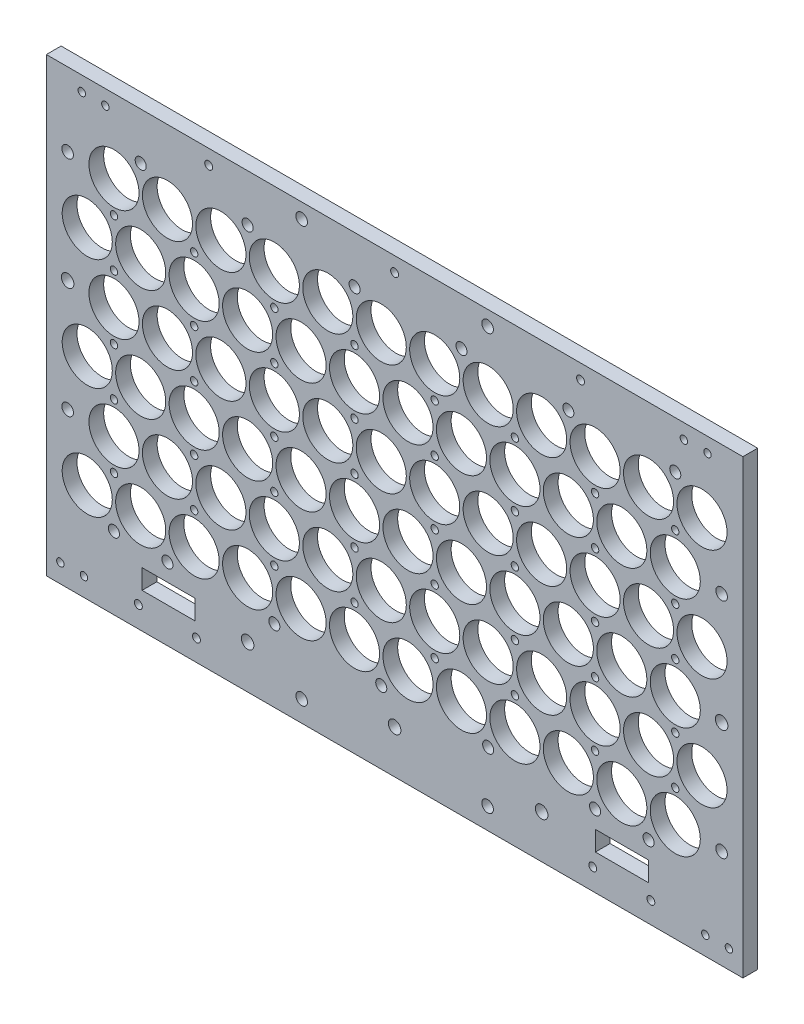
from build123d import *

# Parameters (mm, degrees)
SKETCH1_W                  = 299.700000132
SKETCH1_H                  = 194.250000104
BOSS_EXTRUDE1_DEPTH        = 6.35
CUT_EXTRUDE1_DEPTH         = 182.719853184
SKETCH4_R                  = 10.775
CUT_EXTRUDE2_DEPTH         = 182.719853184
LPATTERN1_COUNT            = 12
LPATTERN1_PITCH            = 23
LPATTERN2_COPY_1_DEPTH     = 182.719853184
LPATTERN2_COPY_2_DEPTH     = 182.719853184
LPATTERN2_COPY_3_DEPTH     = 182.719853184
LPATTERN2_COPY_4_DEPTH     = 182.719853184
LPATTERN2_COPY_5_DEPTH     = 182.719853184
LPATTERN2_COPY_6_DEPTH     = 182.719853184
LPATTERN2_COPY_7_DEPTH     = 182.719853184
LPATTERN2_COPY_8_DEPTH     = 182.719853184
LPATTERN2_COPY_9_DEPTH     = 182.719853184
LPATTERN2_COPY_10_DEPTH    = 182.719853184
LPATTERN2_COPY_11_DEPTH    = 182.719853184
LPATTERN2_COPY_12_DEPTH    = 182.719853184
LPATTERN2_COPY_13_DEPTH    = 182.719853184
LPATTERN2_COPY_14_DEPTH    = 182.719853184
LPATTERN2_COPY_15_DEPTH    = 182.719853184
LPATTERN2_COPY_16_DEPTH    = 182.719853184
LPATTERN2_COPY_17_DEPTH    = 182.719853184
LPATTERN2_COPY_18_DEPTH    = 182.719853184
LPATTERN2_COPY_19_DEPTH    = 182.719853184
LPATTERN2_COPY_20_DEPTH    = 182.719853184
LPATTERN2_COPY_21_DEPTH    = 182.719853184
LPATTERN2_COPY_22_DEPTH    = 182.719853184
LPATTERN2_COPY_23_SKETCH_R = 10.775
LPATTERN2_COPY_23_DEPTH    = 182.719853184
LPATTERN2_COPY_24_SKETCH_R = 10.775
LPATTERN2_COPY_24_DEPTH    = 182.719853184
LPATTERN2_COPY_25_SKETCH_R = 10.775
LPATTERN2_COPY_25_DEPTH    = 182.719853184
LPATTERN2_COPY_26_SKETCH_R = 10.775
LPATTERN2_COPY_26_DEPTH    = 182.719853184
LPATTERN2_COPY_27_SKETCH_R = 10.775
LPATTERN2_COPY_27_DEPTH    = 182.719853184
LPATTERN2_COPY_28_SKETCH_R = 10.775
LPATTERN2_COPY_28_DEPTH    = 182.719853184
LPATTERN2_COPY_29_SKETCH_R = 10.775
LPATTERN2_COPY_29_DEPTH    = 182.719853184
LPATTERN2_COPY_30_SKETCH_R = 10.775
LPATTERN2_COPY_30_DEPTH    = 182.719853184
LPATTERN2_COPY_31_SKETCH_R = 10.775
LPATTERN2_COPY_31_DEPTH    = 182.719853184
LPATTERN2_COPY_32_SKETCH_R = 10.775
LPATTERN2_COPY_32_DEPTH    = 182.719853184
LPATTERN2_COPY_33_SKETCH_R = 10.775
LPATTERN2_COPY_33_DEPTH    = 182.719853184
LPATTERN2_COPY_34_SKETCH_R = 10.775
LPATTERN2_COPY_34_DEPTH    = 182.719853184
LPATTERN2_COPY_35_SKETCH_R = 10.775
LPATTERN2_COPY_35_DEPTH    = 182.719853184
LPATTERN2_COPY_36_SKETCH_R = 10.775
LPATTERN2_COPY_36_DEPTH    = 182.719853184
LPATTERN2_COPY_37_SKETCH_R = 10.775
LPATTERN2_COPY_37_DEPTH    = 182.719853184
LPATTERN2_COPY_38_SKETCH_R = 10.775
LPATTERN2_COPY_38_DEPTH    = 182.719853184
LPATTERN2_COPY_39_SKETCH_R = 10.775
LPATTERN2_COPY_39_DEPTH    = 182.719853184
LPATTERN2_COPY_40_SKETCH_R = 10.775
LPATTERN2_COPY_40_DEPTH    = 182.719853184
LPATTERN2_COPY_41_SKETCH_R = 10.775
LPATTERN2_COPY_41_DEPTH    = 182.719853184
LPATTERN2_COPY_42_SKETCH_R = 10.775
LPATTERN2_COPY_42_DEPTH    = 182.719853184
LPATTERN2_COPY_43_SKETCH_R = 10.775
LPATTERN2_COPY_43_DEPTH    = 182.719853184
LPATTERN2_COPY_44_SKETCH_R = 10.775
LPATTERN2_COPY_44_DEPTH    = 182.719853184
LPATTERN2_COPY_45_DEPTH    = 182.719853184
LPATTERN2_COPY_46_DEPTH    = 182.719853184
LPATTERN2_COPY_47_SKETCH_R = 10.775
LPATTERN2_COPY_47_DEPTH    = 182.719853184
LPATTERN2_COPY_48_SKETCH_R = 10.775
LPATTERN2_COPY_48_DEPTH    = 182.719853184
SKETCH5_W                  = 22.76
SKETCH5_H                  = 8.4615
CUT_EXTRUDE3_DEPTH         = 182.719853184
M3_CLEARANCE_HOLE1_D       = 3.2
M3_CLEARANCE_HOLE2_D       = 3.4
SKETCH14_R                 = 2.7
CUT_EXTRUDE4_DEPTH         = 182.719853184
SKETCH15_R                 = 2.5
CUT_EXTRUDE5_DEPTH         = 182.719853184
SKETCH16_R                 = 1.5875
CUT_EXTRUDE6_DEPTH         = 182.719853184
LPATTERN3_COUNT            = 4
LPATTERN3_PITCH            = 69
SKETCH18_R                 = 2.38125
CUT_EXTRUDE7_DEPTH         = 182.719853184


with BuildPart() as part:
    # Sketch1 → Boss-Extrude1 (new body)
    with BuildSketch(Plane.XY):
        with Locations((0, -5.475000052)):
            Rectangle(SKETCH1_W, SKETCH1_H)
    extrude(amount=BOSS_EXTRUDE1_DEPTH)

    # Sketch3 → Cut-Extrude1 (cut, through all)
    with BuildSketch(Plane.XY.offset(6.35)):
        with BuildLine():
            ThreePointArc((-121.475, -60), (-132.24999993, -49.225), (-143.025, -59.999999859))
            ThreePointArc((-143.025, -59.999999859), (-139.869075617, -67.619075517), (-132.25, -70.775))
            ThreePointArc((-132.25, -70.775), (-124.630924433, -67.619075567), (-121.475, -60))
        make_face()
    cut_extrude1 = extrude(amount=-CUT_EXTRUDE1_DEPTH, mode=Mode.SUBTRACT)

    # Sketch4 → Cut-Extrude2 (cut, through all)
    with BuildSketch(Plane.XY.offset(6.35)):
        with Locations((-120.75, -36)):
            Circle(SKETCH4_R)
    cut_extrude2 = extrude(amount=-CUT_EXTRUDE2_DEPTH, mode=Mode.SUBTRACT)

    # LPattern1: Cut-Extrude1, Cut-Extrude2 ×12
    with Locations(*[(i * LPATTERN1_PITCH, 0, 0) for i in range(1, LPATTERN1_COUNT)]):
        add(cut_extrude1, mode=Mode.SUBTRACT)
        add(cut_extrude2, mode=Mode.SUBTRACT)

    # LPattern2 copy 1 sketch → LPattern2 copy 1 (cut, through all)
    with BuildSketch(Plane(origin=(23, 48, 6.35), x_dir=(1, 0, 0), z_dir=(0, 0, 1))):
        with BuildLine():
            ThreePointArc((-121.475, -60), (-132.24999993, -49.225), (-143.025, -59.999999859))
            ThreePointArc((-143.025, -59.999999859), (-139.869075617, -67.619075517), (-132.25, -70.775))
            ThreePointArc((-132.25, -70.775), (-124.630924433, -67.619075567), (-121.475, -60))
        make_face()
    extrude(amount=-LPATTERN2_COPY_1_DEPTH, mode=Mode.SUBTRACT)

    # LPattern2 copy 2 sketch → LPattern2 copy 2 (cut, through all)
    with BuildSketch(Plane(origin=(23, 96, 6.35), x_dir=(1, 0, 0), z_dir=(0, 0, 1))):
        with BuildLine():
            ThreePointArc((-121.475, -60), (-132.24999993, -49.225), (-143.025, -59.999999859))
            ThreePointArc((-143.025, -59.999999859), (-139.869075617, -67.619075517), (-132.25, -70.775))
            ThreePointArc((-132.25, -70.775), (-124.630924433, -67.619075567), (-121.475, -60))
        make_face()
    extrude(amount=-LPATTERN2_COPY_2_DEPTH, mode=Mode.SUBTRACT)

    # LPattern2 copy 3 sketch → LPattern2 copy 3 (cut, through all)
    with BuildSketch(Plane(origin=(46, 48, 6.35), x_dir=(1, 0, 0), z_dir=(0, 0, 1))):
        with BuildLine():
            ThreePointArc((-121.475, -60), (-132.24999993, -49.225), (-143.025, -59.999999859))
            ThreePointArc((-143.025, -59.999999859), (-139.869075617, -67.619075517), (-132.25, -70.775))
            ThreePointArc((-132.25, -70.775), (-124.630924433, -67.619075567), (-121.475, -60))
        make_face()
    extrude(amount=-LPATTERN2_COPY_3_DEPTH, mode=Mode.SUBTRACT)

    # LPattern2 copy 4 sketch → LPattern2 copy 4 (cut, through all)
    with BuildSketch(Plane(origin=(46, 96, 6.35), x_dir=(1, 0, 0), z_dir=(0, 0, 1))):
        with BuildLine():
            ThreePointArc((-121.475, -60), (-132.24999993, -49.225), (-143.025, -59.999999859))
            ThreePointArc((-143.025, -59.999999859), (-139.869075617, -67.619075517), (-132.25, -70.775))
            ThreePointArc((-132.25, -70.775), (-124.630924433, -67.619075567), (-121.475, -60))
        make_face()
    extrude(amount=-LPATTERN2_COPY_4_DEPTH, mode=Mode.SUBTRACT)

    # LPattern2 copy 5 sketch → LPattern2 copy 5 (cut, through all)
    with BuildSketch(Plane(origin=(69, 48, 6.35), x_dir=(1, 0, 0), z_dir=(0, 0, 1))):
        with BuildLine():
            ThreePointArc((-121.475, -60), (-132.24999993, -49.225), (-143.025, -59.999999859))
            ThreePointArc((-143.025, -59.999999859), (-139.869075617, -67.619075517), (-132.25, -70.775))
            ThreePointArc((-132.25, -70.775), (-124.630924433, -67.619075567), (-121.475, -60))
        make_face()
    extrude(amount=-LPATTERN2_COPY_5_DEPTH, mode=Mode.SUBTRACT)

    # LPattern2 copy 6 sketch → LPattern2 copy 6 (cut, through all)
    with BuildSketch(Plane(origin=(69, 96, 6.35), x_dir=(1, 0, 0), z_dir=(0, 0, 1))):
        with BuildLine():
            ThreePointArc((-121.475, -60), (-132.24999993, -49.225), (-143.025, -59.999999859))
            ThreePointArc((-143.025, -59.999999859), (-139.869075617, -67.619075517), (-132.25, -70.775))
            ThreePointArc((-132.25, -70.775), (-124.630924433, -67.619075567), (-121.475, -60))
        make_face()
    extrude(amount=-LPATTERN2_COPY_6_DEPTH, mode=Mode.SUBTRACT)

    # LPattern2 copy 7 sketch → LPattern2 copy 7 (cut, through all)
    with BuildSketch(Plane(origin=(92, 48, 6.35), x_dir=(1, 0, 0), z_dir=(0, 0, 1))):
        with BuildLine():
            ThreePointArc((-121.475, -60), (-132.24999993, -49.225), (-143.025, -59.999999859))
            ThreePointArc((-143.025, -59.999999859), (-139.869075617, -67.619075517), (-132.25, -70.775))
            ThreePointArc((-132.25, -70.775), (-124.630924433, -67.619075567), (-121.475, -60))
        make_face()
    extrude(amount=-LPATTERN2_COPY_7_DEPTH, mode=Mode.SUBTRACT)

    # LPattern2 copy 8 sketch → LPattern2 copy 8 (cut, through all)
    with BuildSketch(Plane(origin=(92, 96, 6.35), x_dir=(1, 0, 0), z_dir=(0, 0, 1))):
        with BuildLine():
            ThreePointArc((-121.475, -60), (-132.24999993, -49.225), (-143.025, -59.999999859))
            ThreePointArc((-143.025, -59.999999859), (-139.869075617, -67.619075517), (-132.25, -70.775))
            ThreePointArc((-132.25, -70.775), (-124.630924433, -67.619075567), (-121.475, -60))
        make_face()
    extrude(amount=-LPATTERN2_COPY_8_DEPTH, mode=Mode.SUBTRACT)

    # LPattern2 copy 9 sketch → LPattern2 copy 9 (cut, through all)
    with BuildSketch(Plane(origin=(115, 48, 6.35), x_dir=(1, 0, 0), z_dir=(0, 0, 1))):
        with BuildLine():
            ThreePointArc((-121.475, -60), (-132.24999993, -49.225), (-143.025, -59.999999859))
            ThreePointArc((-143.025, -59.999999859), (-139.869075617, -67.619075517), (-132.25, -70.775))
            ThreePointArc((-132.25, -70.775), (-124.630924433, -67.619075567), (-121.475, -60))
        make_face()
    extrude(amount=-LPATTERN2_COPY_9_DEPTH, mode=Mode.SUBTRACT)

    # LPattern2 copy 10 sketch → LPattern2 copy 10 (cut, through all)
    with BuildSketch(Plane(origin=(115, 96, 6.35), x_dir=(1, 0, 0), z_dir=(0, 0, 1))):
        with BuildLine():
            ThreePointArc((-121.475, -60), (-132.24999993, -49.225), (-143.025, -59.999999859))
            ThreePointArc((-143.025, -59.999999859), (-139.869075617, -67.619075517), (-132.25, -70.775))
            ThreePointArc((-132.25, -70.775), (-124.630924433, -67.619075567), (-121.475, -60))
        make_face()
    extrude(amount=-LPATTERN2_COPY_10_DEPTH, mode=Mode.SUBTRACT)

    # LPattern2 copy 11 sketch → LPattern2 copy 11 (cut, through all)
    with BuildSketch(Plane(origin=(138, 48, 6.35), x_dir=(1, 0, 0), z_dir=(0, 0, 1))):
        with BuildLine():
            ThreePointArc((-121.475, -60), (-132.24999993, -49.225), (-143.025, -59.999999859))
            ThreePointArc((-143.025, -59.999999859), (-139.869075617, -67.619075517), (-132.25, -70.775))
            ThreePointArc((-132.25, -70.775), (-124.630924433, -67.619075567), (-121.475, -60))
        make_face()
    extrude(amount=-LPATTERN2_COPY_11_DEPTH, mode=Mode.SUBTRACT)

    # LPattern2 copy 12 sketch → LPattern2 copy 12 (cut, through all)
    with BuildSketch(Plane(origin=(138, 96, 6.35), x_dir=(1, 0, 0), z_dir=(0, 0, 1))):
        with BuildLine():
            ThreePointArc((-121.475, -60), (-132.24999993, -49.225), (-143.025, -59.999999859))
            ThreePointArc((-143.025, -59.999999859), (-139.869075617, -67.619075517), (-132.25, -70.775))
            ThreePointArc((-132.25, -70.775), (-124.630924433, -67.619075567), (-121.475, -60))
        make_face()
    extrude(amount=-LPATTERN2_COPY_12_DEPTH, mode=Mode.SUBTRACT)

    # LPattern2 copy 13 sketch → LPattern2 copy 13 (cut, through all)
    with BuildSketch(Plane(origin=(161, 48, 6.35), x_dir=(1, 0, 0), z_dir=(0, 0, 1))):
        with BuildLine():
            ThreePointArc((-121.475, -60), (-132.24999993, -49.225), (-143.025, -59.999999859))
            ThreePointArc((-143.025, -59.999999859), (-139.869075617, -67.619075517), (-132.25, -70.775))
            ThreePointArc((-132.25, -70.775), (-124.630924433, -67.619075567), (-121.475, -60))
        make_face()
    extrude(amount=-LPATTERN2_COPY_13_DEPTH, mode=Mode.SUBTRACT)

    # LPattern2 copy 14 sketch → LPattern2 copy 14 (cut, through all)
    with BuildSketch(Plane(origin=(161, 96, 6.35), x_dir=(1, 0, 0), z_dir=(0, 0, 1))):
        with BuildLine():
            ThreePointArc((-121.475, -60), (-132.24999993, -49.225), (-143.025, -59.999999859))
            ThreePointArc((-143.025, -59.999999859), (-139.869075617, -67.619075517), (-132.25, -70.775))
            ThreePointArc((-132.25, -70.775), (-124.630924433, -67.619075567), (-121.475, -60))
        make_face()
    extrude(amount=-LPATTERN2_COPY_14_DEPTH, mode=Mode.SUBTRACT)

    # LPattern2 copy 15 sketch → LPattern2 copy 15 (cut, through all)
    with BuildSketch(Plane(origin=(184, 48, 6.35), x_dir=(1, 0, 0), z_dir=(0, 0, 1))):
        with BuildLine():
            ThreePointArc((-121.475, -60), (-132.24999993, -49.225), (-143.025, -59.999999859))
            ThreePointArc((-143.025, -59.999999859), (-139.869075617, -67.619075517), (-132.25, -70.775))
            ThreePointArc((-132.25, -70.775), (-124.630924433, -67.619075567), (-121.475, -60))
        make_face()
    extrude(amount=-LPATTERN2_COPY_15_DEPTH, mode=Mode.SUBTRACT)

    # LPattern2 copy 16 sketch → LPattern2 copy 16 (cut, through all)
    with BuildSketch(Plane(origin=(184, 96, 6.35), x_dir=(1, 0, 0), z_dir=(0, 0, 1))):
        with BuildLine():
            ThreePointArc((-121.475, -60), (-132.24999993, -49.225), (-143.025, -59.999999859))
            ThreePointArc((-143.025, -59.999999859), (-139.869075617, -67.619075517), (-132.25, -70.775))
            ThreePointArc((-132.25, -70.775), (-124.630924433, -67.619075567), (-121.475, -60))
        make_face()
    extrude(amount=-LPATTERN2_COPY_16_DEPTH, mode=Mode.SUBTRACT)

    # LPattern2 copy 17 sketch → LPattern2 copy 17 (cut, through all)
    with BuildSketch(Plane(origin=(207, 48, 6.35), x_dir=(1, 0, 0), z_dir=(0, 0, 1))):
        with BuildLine():
            ThreePointArc((-121.475, -60), (-132.24999993, -49.225), (-143.025, -59.999999859))
            ThreePointArc((-143.025, -59.999999859), (-139.869075617, -67.619075517), (-132.25, -70.775))
            ThreePointArc((-132.25, -70.775), (-124.630924433, -67.619075567), (-121.475, -60))
        make_face()
    extrude(amount=-LPATTERN2_COPY_17_DEPTH, mode=Mode.SUBTRACT)

    # LPattern2 copy 18 sketch → LPattern2 copy 18 (cut, through all)
    with BuildSketch(Plane(origin=(207, 96, 6.35), x_dir=(1, 0, 0), z_dir=(0, 0, 1))):
        with BuildLine():
            ThreePointArc((-121.475, -60), (-132.24999993, -49.225), (-143.025, -59.999999859))
            ThreePointArc((-143.025, -59.999999859), (-139.869075617, -67.619075517), (-132.25, -70.775))
            ThreePointArc((-132.25, -70.775), (-124.630924433, -67.619075567), (-121.475, -60))
        make_face()
    extrude(amount=-LPATTERN2_COPY_18_DEPTH, mode=Mode.SUBTRACT)

    # LPattern2 copy 19 sketch → LPattern2 copy 19 (cut, through all)
    with BuildSketch(Plane(origin=(230, 48, 6.35), x_dir=(1, 0, 0), z_dir=(0, 0, 1))):
        with BuildLine():
            ThreePointArc((-121.475, -60), (-132.24999993, -49.225), (-143.025, -59.999999859))
            ThreePointArc((-143.025, -59.999999859), (-139.869075617, -67.619075517), (-132.25, -70.775))
            ThreePointArc((-132.25, -70.775), (-124.630924433, -67.619075567), (-121.475, -60))
        make_face()
    extrude(amount=-LPATTERN2_COPY_19_DEPTH, mode=Mode.SUBTRACT)

    # LPattern2 copy 20 sketch → LPattern2 copy 20 (cut, through all)
    with BuildSketch(Plane(origin=(230, 96, 6.35), x_dir=(1, 0, 0), z_dir=(0, 0, 1))):
        with BuildLine():
            ThreePointArc((-121.475, -60), (-132.24999993, -49.225), (-143.025, -59.999999859))
            ThreePointArc((-143.025, -59.999999859), (-139.869075617, -67.619075517), (-132.25, -70.775))
            ThreePointArc((-132.25, -70.775), (-124.630924433, -67.619075567), (-121.475, -60))
        make_face()
    extrude(amount=-LPATTERN2_COPY_20_DEPTH, mode=Mode.SUBTRACT)

    # LPattern2 copy 21 sketch → LPattern2 copy 21 (cut, through all)
    with BuildSketch(Plane(origin=(253, 48, 6.35), x_dir=(1, 0, 0), z_dir=(0, 0, 1))):
        with BuildLine():
            ThreePointArc((-121.475, -60), (-132.24999993, -49.225), (-143.025, -59.999999859))
            ThreePointArc((-143.025, -59.999999859), (-139.869075617, -67.619075517), (-132.25, -70.775))
            ThreePointArc((-132.25, -70.775), (-124.630924433, -67.619075567), (-121.475, -60))
        make_face()
    extrude(amount=-LPATTERN2_COPY_21_DEPTH, mode=Mode.SUBTRACT)

    # LPattern2 copy 22 sketch → LPattern2 copy 22 (cut, through all)
    with BuildSketch(Plane(origin=(253, 96, 6.35), x_dir=(1, 0, 0), z_dir=(0, 0, 1))):
        with BuildLine():
            ThreePointArc((-121.475, -60), (-132.24999993, -49.225), (-143.025, -59.999999859))
            ThreePointArc((-143.025, -59.999999859), (-139.869075617, -67.619075517), (-132.25, -70.775))
            ThreePointArc((-132.25, -70.775), (-124.630924433, -67.619075567), (-121.475, -60))
        make_face()
    extrude(amount=-LPATTERN2_COPY_22_DEPTH, mode=Mode.SUBTRACT)

    # LPattern2 copy 23 sketch → LPattern2 copy 23 (cut, through all)
    with BuildSketch(Plane(origin=(23, 48, 6.35), x_dir=(1, 0, 0), z_dir=(0, 0, 1))):
        with Locations((-120.75, -36)):
            Circle(LPATTERN2_COPY_23_SKETCH_R)
    extrude(amount=-LPATTERN2_COPY_23_DEPTH, mode=Mode.SUBTRACT)

    # LPattern2 copy 24 sketch → LPattern2 copy 24 (cut, through all)
    with BuildSketch(Plane(origin=(23, 96, 6.35), x_dir=(1, 0, 0), z_dir=(0, 0, 1))):
        with Locations((-120.75, -36)):
            Circle(LPATTERN2_COPY_24_SKETCH_R)
    extrude(amount=-LPATTERN2_COPY_24_DEPTH, mode=Mode.SUBTRACT)

    # LPattern2 copy 25 sketch → LPattern2 copy 25 (cut, through all)
    with BuildSketch(Plane(origin=(46, 48, 6.35), x_dir=(1, 0, 0), z_dir=(0, 0, 1))):
        with Locations((-120.75, -36)):
            Circle(LPATTERN2_COPY_25_SKETCH_R)
    extrude(amount=-LPATTERN2_COPY_25_DEPTH, mode=Mode.SUBTRACT)

    # LPattern2 copy 26 sketch → LPattern2 copy 26 (cut, through all)
    with BuildSketch(Plane(origin=(46, 96, 6.35), x_dir=(1, 0, 0), z_dir=(0, 0, 1))):
        with Locations((-120.75, -36)):
            Circle(LPATTERN2_COPY_26_SKETCH_R)
    extrude(amount=-LPATTERN2_COPY_26_DEPTH, mode=Mode.SUBTRACT)

    # LPattern2 copy 27 sketch → LPattern2 copy 27 (cut, through all)
    with BuildSketch(Plane(origin=(69, 48, 6.35), x_dir=(1, 0, 0), z_dir=(0, 0, 1))):
        with Locations((-120.75, -36)):
            Circle(LPATTERN2_COPY_27_SKETCH_R)
    extrude(amount=-LPATTERN2_COPY_27_DEPTH, mode=Mode.SUBTRACT)

    # LPattern2 copy 28 sketch → LPattern2 copy 28 (cut, through all)
    with BuildSketch(Plane(origin=(69, 96, 6.35), x_dir=(1, 0, 0), z_dir=(0, 0, 1))):
        with Locations((-120.75, -36)):
            Circle(LPATTERN2_COPY_28_SKETCH_R)
    extrude(amount=-LPATTERN2_COPY_28_DEPTH, mode=Mode.SUBTRACT)

    # LPattern2 copy 29 sketch → LPattern2 copy 29 (cut, through all)
    with BuildSketch(Plane(origin=(92, 48, 6.35), x_dir=(1, 0, 0), z_dir=(0, 0, 1))):
        with Locations((-120.75, -36)):
            Circle(LPATTERN2_COPY_29_SKETCH_R)
    extrude(amount=-LPATTERN2_COPY_29_DEPTH, mode=Mode.SUBTRACT)

    # LPattern2 copy 30 sketch → LPattern2 copy 30 (cut, through all)
    with BuildSketch(Plane(origin=(92, 96, 6.35), x_dir=(1, 0, 0), z_dir=(0, 0, 1))):
        with Locations((-120.75, -36)):
            Circle(LPATTERN2_COPY_30_SKETCH_R)
    extrude(amount=-LPATTERN2_COPY_30_DEPTH, mode=Mode.SUBTRACT)

    # LPattern2 copy 31 sketch → LPattern2 copy 31 (cut, through all)
    with BuildSketch(Plane(origin=(115, 48, 6.35), x_dir=(1, 0, 0), z_dir=(0, 0, 1))):
        with Locations((-120.75, -36)):
            Circle(LPATTERN2_COPY_31_SKETCH_R)
    extrude(amount=-LPATTERN2_COPY_31_DEPTH, mode=Mode.SUBTRACT)

    # LPattern2 copy 32 sketch → LPattern2 copy 32 (cut, through all)
    with BuildSketch(Plane(origin=(115, 96, 6.35), x_dir=(1, 0, 0), z_dir=(0, 0, 1))):
        with Locations((-120.75, -36)):
            Circle(LPATTERN2_COPY_32_SKETCH_R)
    extrude(amount=-LPATTERN2_COPY_32_DEPTH, mode=Mode.SUBTRACT)

    # LPattern2 copy 33 sketch → LPattern2 copy 33 (cut, through all)
    with BuildSketch(Plane(origin=(138, 48, 6.35), x_dir=(1, 0, 0), z_dir=(0, 0, 1))):
        with Locations((-120.75, -36)):
            Circle(LPATTERN2_COPY_33_SKETCH_R)
    extrude(amount=-LPATTERN2_COPY_33_DEPTH, mode=Mode.SUBTRACT)

    # LPattern2 copy 34 sketch → LPattern2 copy 34 (cut, through all)
    with BuildSketch(Plane(origin=(138, 96, 6.35), x_dir=(1, 0, 0), z_dir=(0, 0, 1))):
        with Locations((-120.75, -36)):
            Circle(LPATTERN2_COPY_34_SKETCH_R)
    extrude(amount=-LPATTERN2_COPY_34_DEPTH, mode=Mode.SUBTRACT)

    # LPattern2 copy 35 sketch → LPattern2 copy 35 (cut, through all)
    with BuildSketch(Plane(origin=(161, 48, 6.35), x_dir=(1, 0, 0), z_dir=(0, 0, 1))):
        with Locations((-120.75, -36)):
            Circle(LPATTERN2_COPY_35_SKETCH_R)
    extrude(amount=-LPATTERN2_COPY_35_DEPTH, mode=Mode.SUBTRACT)

    # LPattern2 copy 36 sketch → LPattern2 copy 36 (cut, through all)
    with BuildSketch(Plane(origin=(161, 96, 6.35), x_dir=(1, 0, 0), z_dir=(0, 0, 1))):
        with Locations((-120.75, -36)):
            Circle(LPATTERN2_COPY_36_SKETCH_R)
    extrude(amount=-LPATTERN2_COPY_36_DEPTH, mode=Mode.SUBTRACT)

    # LPattern2 copy 37 sketch → LPattern2 copy 37 (cut, through all)
    with BuildSketch(Plane(origin=(184, 48, 6.35), x_dir=(1, 0, 0), z_dir=(0, 0, 1))):
        with Locations((-120.75, -36)):
            Circle(LPATTERN2_COPY_37_SKETCH_R)
    extrude(amount=-LPATTERN2_COPY_37_DEPTH, mode=Mode.SUBTRACT)

    # LPattern2 copy 38 sketch → LPattern2 copy 38 (cut, through all)
    with BuildSketch(Plane(origin=(184, 96, 6.35), x_dir=(1, 0, 0), z_dir=(0, 0, 1))):
        with Locations((-120.75, -36)):
            Circle(LPATTERN2_COPY_38_SKETCH_R)
    extrude(amount=-LPATTERN2_COPY_38_DEPTH, mode=Mode.SUBTRACT)

    # LPattern2 copy 39 sketch → LPattern2 copy 39 (cut, through all)
    with BuildSketch(Plane(origin=(207, 48, 6.35), x_dir=(1, 0, 0), z_dir=(0, 0, 1))):
        with Locations((-120.75, -36)):
            Circle(LPATTERN2_COPY_39_SKETCH_R)
    extrude(amount=-LPATTERN2_COPY_39_DEPTH, mode=Mode.SUBTRACT)

    # LPattern2 copy 40 sketch → LPattern2 copy 40 (cut, through all)
    with BuildSketch(Plane(origin=(207, 96, 6.35), x_dir=(1, 0, 0), z_dir=(0, 0, 1))):
        with Locations((-120.75, -36)):
            Circle(LPATTERN2_COPY_40_SKETCH_R)
    extrude(amount=-LPATTERN2_COPY_40_DEPTH, mode=Mode.SUBTRACT)

    # LPattern2 copy 41 sketch → LPattern2 copy 41 (cut, through all)
    with BuildSketch(Plane(origin=(230, 48, 6.35), x_dir=(1, 0, 0), z_dir=(0, 0, 1))):
        with Locations((-120.75, -36)):
            Circle(LPATTERN2_COPY_41_SKETCH_R)
    extrude(amount=-LPATTERN2_COPY_41_DEPTH, mode=Mode.SUBTRACT)

    # LPattern2 copy 42 sketch → LPattern2 copy 42 (cut, through all)
    with BuildSketch(Plane(origin=(230, 96, 6.35), x_dir=(1, 0, 0), z_dir=(0, 0, 1))):
        with Locations((-120.75, -36)):
            Circle(LPATTERN2_COPY_42_SKETCH_R)
    extrude(amount=-LPATTERN2_COPY_42_DEPTH, mode=Mode.SUBTRACT)

    # LPattern2 copy 43 sketch → LPattern2 copy 43 (cut, through all)
    with BuildSketch(Plane(origin=(253, 48, 6.35), x_dir=(1, 0, 0), z_dir=(0, 0, 1))):
        with Locations((-120.75, -36)):
            Circle(LPATTERN2_COPY_43_SKETCH_R)
    extrude(amount=-LPATTERN2_COPY_43_DEPTH, mode=Mode.SUBTRACT)

    # LPattern2 copy 44 sketch → LPattern2 copy 44 (cut, through all)
    with BuildSketch(Plane(origin=(253, 96, 6.35), x_dir=(1, 0, 0), z_dir=(0, 0, 1))):
        with Locations((-120.75, -36)):
            Circle(LPATTERN2_COPY_44_SKETCH_R)
    extrude(amount=-LPATTERN2_COPY_44_DEPTH, mode=Mode.SUBTRACT)

    # LPattern2 copy 45 sketch → LPattern2 copy 45 (cut, through all)
    with BuildSketch(Plane(origin=(0, 48, 6.35), x_dir=(1, 0, 0), z_dir=(0, 0, 1))):
        with BuildLine():
            ThreePointArc((-121.475, -60), (-132.24999993, -49.225), (-143.025, -59.999999859))
            ThreePointArc((-143.025, -59.999999859), (-139.869075617, -67.619075517), (-132.25, -70.775))
            ThreePointArc((-132.25, -70.775), (-124.630924433, -67.619075567), (-121.475, -60))
        make_face()
    extrude(amount=-LPATTERN2_COPY_45_DEPTH, mode=Mode.SUBTRACT)

    # LPattern2 copy 46 sketch → LPattern2 copy 46 (cut, through all)
    with BuildSketch(Plane(origin=(0, 96, 6.35), x_dir=(1, 0, 0), z_dir=(0, 0, 1))):
        with BuildLine():
            ThreePointArc((-121.475, -60), (-132.24999993, -49.225), (-143.025, -59.999999859))
            ThreePointArc((-143.025, -59.999999859), (-139.869075617, -67.619075517), (-132.25, -70.775))
            ThreePointArc((-132.25, -70.775), (-124.630924433, -67.619075567), (-121.475, -60))
        make_face()
    extrude(amount=-LPATTERN2_COPY_46_DEPTH, mode=Mode.SUBTRACT)

    # LPattern2 copy 47 sketch → LPattern2 copy 47 (cut, through all)
    with BuildSketch(Plane(origin=(0, 48, 6.35), x_dir=(1, 0, 0), z_dir=(0, 0, 1))):
        with Locations((-120.75, -36)):
            Circle(LPATTERN2_COPY_47_SKETCH_R)
    extrude(amount=-LPATTERN2_COPY_47_DEPTH, mode=Mode.SUBTRACT)

    # LPattern2 copy 48 sketch → LPattern2 copy 48 (cut, through all)
    with BuildSketch(Plane(origin=(0, 96, 6.35), x_dir=(1, 0, 0), z_dir=(0, 0, 1))):
        with Locations((-120.75, -36)):
            Circle(LPATTERN2_COPY_48_SKETCH_R)
    extrude(amount=-LPATTERN2_COPY_48_DEPTH, mode=Mode.SUBTRACT)

    # Sketch5 → Cut-Extrude3 (cut, through all)
    with BuildSketch(Plane.XY.offset(6.35)):
        with Locations((97.75, -83.18075)):
            Rectangle(SKETCH5_W, SKETCH5_H)
        with Locations((-97.288, -83.18075)):
            Rectangle(SKETCH5_W, SKETCH5_H)
    extrude(amount=-CUT_EXTRUDE3_DEPTH, mode=Mode.SUBTRACT)

    # M3 Clearance Hole1 (through all)
    with Locations(Plane.XY.offset(6.35)):
        with Locations((124.450000066, 85.3), (134.610000066, 85.3), (-124.450000066, 85.3), (-134.610000066, 85.3), (-143.817500066, -94.6000001), (-133.657500066, -94.6000001), (133.657500066, -94.6000001), (143.817500066, -94.6000001)):
            Hole(M3_CLEARANCE_HOLE1_D / 2)

    # M3 Clearance Hole2 (through all)
    with Locations(Plane.XY.offset(6.35)):
        with Locations((110.25, -93.50575), (85.25, -93.50575), (-80, 85.3), (0, 85.3), (80, 85.3), (-85.25, -93.50575), (-110.25, -93.50575)):
            Hole(M3_CLEARANCE_HOLE2_D / 2)

    # Sketch14 → Cut-Extrude4 (cut, through all)
    with BuildSketch(Plane.XY.offset(6.35)):
        with Locations((140.687500033, -12)):
            Circle(SKETCH14_R)
        with Locations((-140.687500033, 12)):
            Circle(SKETCH14_R)
        with Locations((63.25, -83.95)):
            Circle(SKETCH14_R)
        with Locations((-63.25, -83.95)):
            Circle(SKETCH14_R)
        with Locations((0, -83.95)):
            Circle(SKETCH14_R)
    extrude(amount=-CUT_EXTRUDE4_DEPTH, mode=Mode.SUBTRACT)

    # Sketch15 → Cut-Extrude5 (cut, through all)
    with BuildSketch(Plane.XY.offset(6.35)):
        with Locations((-40, 85.3)):
            Circle(SKETCH15_R)
        with Locations((40, 85.3)):
            Circle(SKETCH15_R)
        with Locations((140.687500033, 36)):
            Circle(SKETCH15_R)
        with Locations((140.687500033, -60)):
            Circle(SKETCH15_R)
        with Locations((-140.687500033, -36)):
            Circle(SKETCH15_R)
        with Locations((-140.687500033, 60)):
            Circle(SKETCH15_R)
        with Locations((-40, -93.50575)):
            Circle(SKETCH15_R)
        with Locations((40, -93.50575)):
            Circle(SKETCH15_R)
    extrude(amount=-CUT_EXTRUDE5_DEPTH, mode=Mode.SUBTRACT)

    # Sketch16 → Cut-Extrude6 (cut, through all)
    with BuildSketch(Plane.XY.offset(6.35)):
        with Locations((86.25, -49.71)):
            Circle(SKETCH16_R)
        with Locations((120.75, -46.29)):
            Circle(SKETCH16_R)
        with Locations((120.75, -25.71)):
            Circle(SKETCH16_R)
        with Locations((86.25, -22.29)):
            Circle(SKETCH16_R)
        with Locations((120.75, 1.71)):
            Circle(SKETCH16_R)
        with Locations((86.25, -1.71)):
            Circle(SKETCH16_R)
        with Locations((120.75, 22.29)):
            Circle(SKETCH16_R)
        with Locations((86.25, 25.71)):
            Circle(SKETCH16_R)
        with Locations((120.75, 49.71)):
            Circle(SKETCH16_R)
        with Locations((86.25, 46.29)):
            Circle(SKETCH16_R)
    cut_extrude6 = extrude(amount=-CUT_EXTRUDE6_DEPTH, mode=Mode.SUBTRACT)

    # LPattern3: Cut-Extrude6 ×4
    with Locations(*[(-i * LPATTERN3_PITCH, 0, 0) for i in range(1, LPATTERN3_COUNT)]):
        add(cut_extrude6, mode=Mode.SUBTRACT)

    # Sketch18 → Cut-Extrude7 (cut, through all)
    with BuildSketch(Plane.XY.offset(6.35)):
        with Locations((109.25, -71.41)):
            Circle(SKETCH18_R)
        with Locations((86.25, -71.41)):
            Circle(SKETCH18_R)
        with Locations((120.75, 71.41)):
            Circle(SKETCH18_R)
        with Locations((74.75, 71.41)):
            Circle(SKETCH18_R)
        with Locations((28.75, 71.41)):
            Circle(SKETCH18_R)
        with Locations((-17.25, 71.41)):
            Circle(SKETCH18_R)
        with Locations((-63.25, 71.41)):
            Circle(SKETCH18_R)
        with Locations((-109.25, 71.41)):
            Circle(SKETCH18_R)
        with Locations((40.25, -71.41)):
            Circle(SKETCH18_R)
        with Locations((-5.75, -71.41)):
            Circle(SKETCH18_R)
        with Locations((-51.75, -71.41)):
            Circle(SKETCH18_R)
        with Locations((-97.75, -71.41)):
            Circle(SKETCH18_R)
        with Locations((-120.75, -71.41)):
            Circle(SKETCH18_R)
    extrude(amount=-CUT_EXTRUDE7_DEPTH, mode=Mode.SUBTRACT)


solid = part.part
